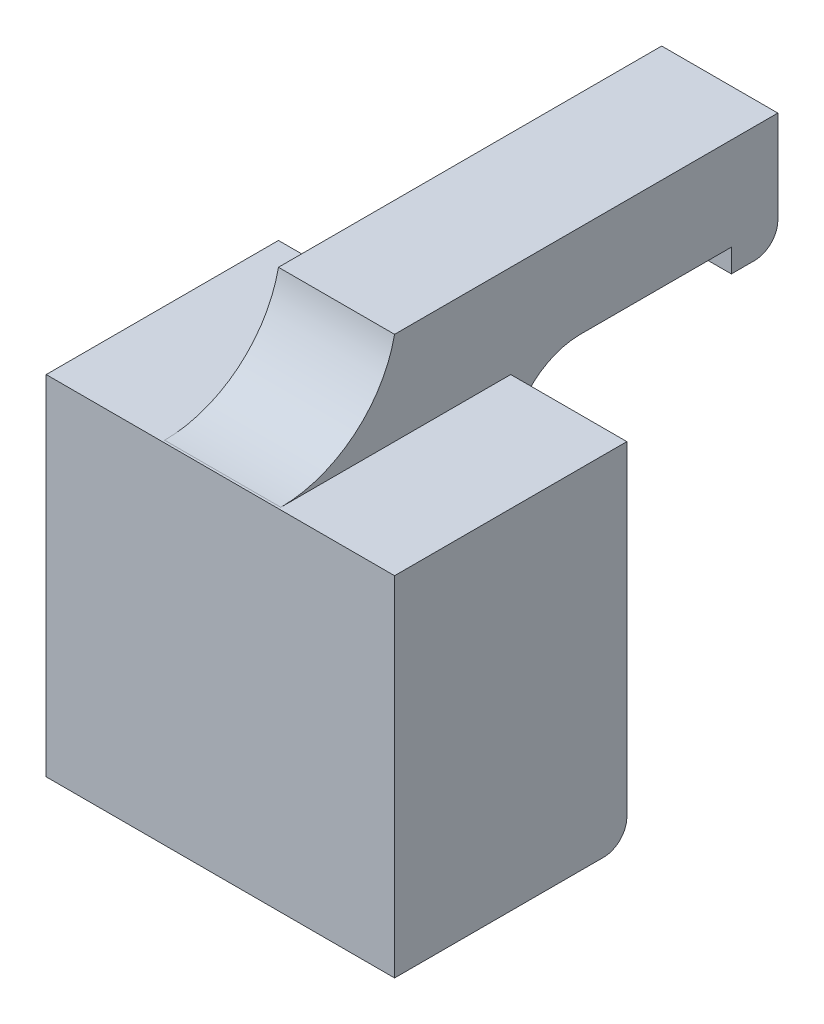
from build123d import *

# Parameters (mm, degrees)
SKETCH1_W           = 15
SKETCH1_H           = 15
BOSS_EXTRUDE1_DEPTH = 10
SKETCH2_R           = 2.75
BOSS_EXTRUDE2_DEPTH = 3
SKETCH3_W           = 2.5
SKETCH3_H           = 5
BOSS_EXTRUDE3_DEPTH = 4
FILLET1_R           = 5
FILLET2_R           = 3
SKETCH4_W           = 5
SKETCH4_H           = 2
BOSS_EXTRUDE4_DEPTH = 1
FILLET3_R           = 1
SKETCH5_W           = 2.75
SKETCH5_H           = 7.677004104
CUT_EXTRUDE1_DEPTH  = 1
SKETCH6_R           = 1
CUT_EXTRUDE2_DEPTH  = 8
SKETCH7_R           = 0.875
BOSS_EXTRUDE5_DEPTH = 7.5
FILLET5_R           = 1


with BuildPart() as part:
    # Sketch1 → Boss-Extrude1 (new body)
    with BuildSketch(Plane.XY):
        Rectangle(SKETCH1_W, SKETCH1_H)
    extrude(amount=BOSS_EXTRUDE1_DEPTH)

    # Sketch2 → Boss-Extrude2 (add)
    with BuildSketch(Plane(origin=(0, 0, 0), x_dir=(-1, 0, 0), z_dir=(0, 0, -1))):
        Circle(SKETCH2_R)
    extrude(amount=BOSS_EXTRUDE2_DEPTH)

    # Sketch3 → Boss-Extrude3 (add)
    with BuildSketch(Plane(origin=(0, 7.5, 0), x_dir=(1, 0, 0), z_dir=(0, 1, 0))):
        Polygon((-2.5, 0), (0, 0), (2.5, 0), (2.5, 11.5), (-2.5, 11.5), align=None)
        with Locations((1.25, -2.5)):
            Rectangle(SKETCH3_W, SKETCH3_H)
        with Locations((-1.25, -2.5)):
            Rectangle(SKETCH3_W, SKETCH3_H)
    extrude(amount=BOSS_EXTRUDE3_DEPTH)

    # Fillet1
    # the kernel refuses this fillet: 5 mm, written as the material it adds along each edge
    with BuildSketch(Plane(origin=(2.5, 7.5, 5), x_dir=(0, 0, 1), z_dir=(-1, 0, 0))) as fillet1_piece_1:
        with BuildLine():
            CenterArc((4.898979486, 5), FILLET1_R, 191.536959033, 78.463040967)
            Line((0, 4), (-0.09797959, 3.98))
            ThreePointArc((-0.09797959, 3.98), (-0.1, 2), (-0.1, 0))
            Line((-0.1, 0), (0, -0.1))
            Line((0, -0.1), (4.898979486, -0.1))
            Line((4.898979486, -0.1), (4.898979486, 0))
        make_face()
    extrude(amount=5)

    # Fillet2
    fillet2_edges = [part.edges().sort_by_distance(p)[0] for p in [
        (0, 7.5, 0),
    ]]
    fillet(fillet2_edges, radius=FILLET2_R)

    # Sketch4 → Boss-Extrude4 (add)
    with BuildSketch(Plane.XZ.offset(-7.5)):
        with Locations((0, -10.5)):
            Rectangle(SKETCH4_W, SKETCH4_H)
    extrude(amount=BOSS_EXTRUDE4_DEPTH)

    # Fillet3
    fillet3_edges = [part.edges().sort_by_distance(p)[0] for p in [
        (0, 6.5, -11.5),
    ]]
    fillet(fillet3_edges, radius=FILLET3_R)

    # Sketch5 → Cut-Extrude1 (cut)
    with BuildSketch(Plane.XZ.offset(7.5)):
        with Locations((-1.375, 5)):
            Rectangle(SKETCH5_W, SKETCH5_H)
        with Locations((1.375, 5)):
            Rectangle(SKETCH5_W, SKETCH5_H)
    extrude(amount=-CUT_EXTRUDE1_DEPTH, mode=Mode.SUBTRACT)

    # Sketch6 → Cut-Extrude2 (cut)
    with BuildSketch(Plane(origin=(0, 0, 0), x_dir=(-1, 0, 0), z_dir=(0, 0, -1))):
        with Locations((-5, 0)):
            Circle(SKETCH6_R)
    extrude(amount=-CUT_EXTRUDE2_DEPTH, mode=Mode.SUBTRACT)

    # Sketch7 → Boss-Extrude5 (add)
    with BuildSketch(Plane(origin=(0, 0, 0), x_dir=(-1, 0, 0), z_dir=(0, 0, -1))):
        with Locations((5, 0)):
            Circle(SKETCH7_R)
    extrude(amount=BOSS_EXTRUDE5_DEPTH)

    # Fillet5
    fillet5_edges = [part.edges().sort_by_distance(p)[0] for p in [
        (0, -7.5, 0),
    ]]
    fillet(fillet5_edges, radius=FILLET5_R)


solid = part.part
